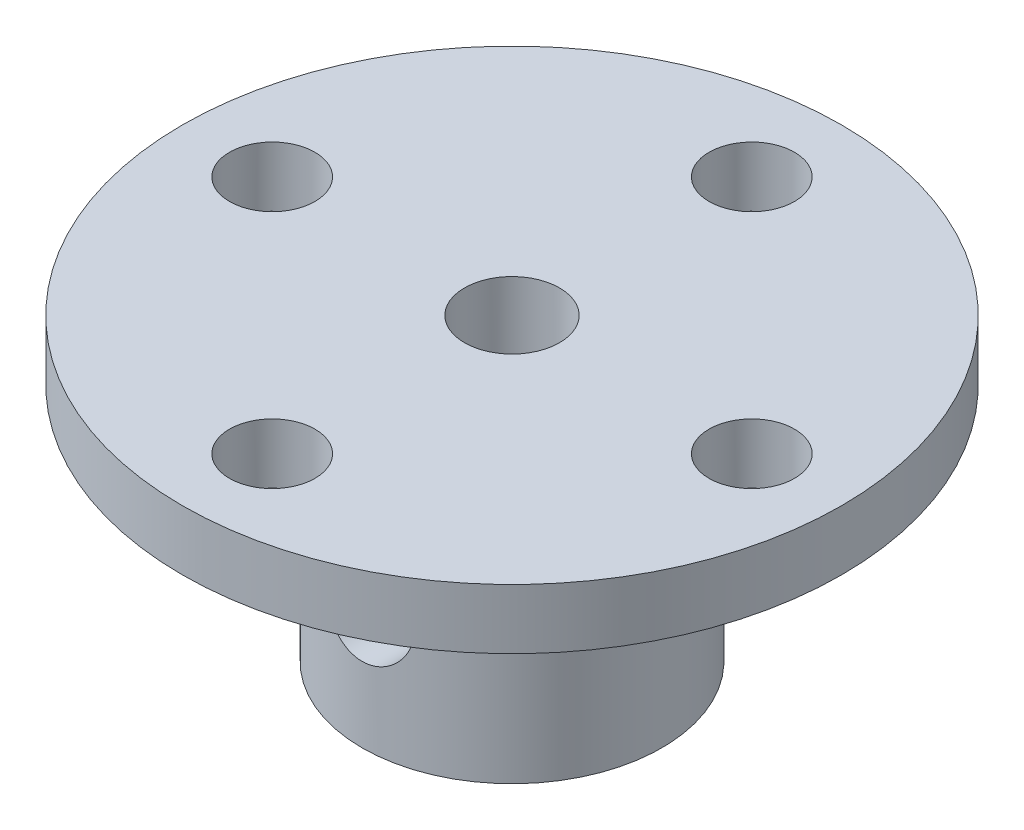
from build123d import *

# Parameters (mm, degrees)
SKETCH1_R               = 11
BOSS_EXTRUDE1_DEPTH     = 2
SKETCH2_R               = 5
BOSS_EXTRUDE2_DEPTH     = 8
SKETCH3_R               = 1.585
CUT_EXTRUDE1_DEPTH      = 19.493242009
CUT_EXTRUDE2_REACH      = 20.493
SKETCH4_R               = 1.425
CIRPATTERN1_COUNT       = 4
CUT_EXTRUDE3_DEPTH      = 18.492855685
CUT_EXTRUDE3_DEPTH_BACK = 18.492855685
SKETCH5_R               = 1.5


with BuildPart() as part:
    # Sketch1 → Boss-Extrude1 (new body)
    with BuildSketch(Plane(origin=(0, 0, 0), x_dir=(1, 0, 0), z_dir=(0, 1, 0))):
        Circle(SKETCH1_R)
    extrude(amount=BOSS_EXTRUDE1_DEPTH)

    # Sketch2 → Boss-Extrude2 (add)
    with BuildSketch(Plane(origin=(0, 0, 0), x_dir=(1, 0, 0), z_dir=(0, 1, 0))):
        Circle(SKETCH2_R)
    extrude(amount=-BOSS_EXTRUDE2_DEPTH)

    # Sketch3 → Cut-Extrude1 (cut, through all)
    with BuildSketch(Plane(origin=(0, 2, 0), x_dir=(-1, 0, 0), z_dir=(0, -1, 0))):
        Circle(SKETCH3_R)
    extrude(amount=CUT_EXTRUDE1_DEPTH, mode=Mode.SUBTRACT)

    # Sketch4 → Cut-Extrude2 (cut, up to next)
    with BuildSketch(Plane(origin=(0, 2, 0), x_dir=(1, 0, 0), z_dir=(0, 1, 0)), mode=Mode.PRIVATE) as cut_extrude2_sk1:
        with Locations((0, 8)):
            Circle(SKETCH4_R)
    cut_extrude2_tool1 = extrude(cut_extrude2_sk1.sketch, amount=-CUT_EXTRUDE2_REACH, mode=Mode.PRIVATE) & part.part
    cut_extrude2 = cut_extrude2_tool1.solids().sort_by_distance((0, 2, -8))[0]
    add(cut_extrude2, mode=Mode.SUBTRACT)

    # CirPattern1: Cut-Extrude2 ×4 about axis
    cirpattern1_axis = Axis((0, 2, 0), (0, 1, 0))
    for i in range(1, CIRPATTERN1_COUNT):
        add(cut_extrude2.rotate(cirpattern1_axis, i * 360 / CIRPATTERN1_COUNT), mode=Mode.SUBTRACT)

    # Sketch5 → Cut-Extrude3 (cut, two sides: drawn at the far end of the back side and taken through both)
    with BuildSketch(Plane.XY.offset(-CUT_EXTRUDE3_DEPTH_BACK)):
        with Locations((0, -4)):
            Circle(SKETCH5_R)
    extrude(amount=CUT_EXTRUDE3_DEPTH + CUT_EXTRUDE3_DEPTH_BACK, mode=Mode.SUBTRACT)


solid = part.part
